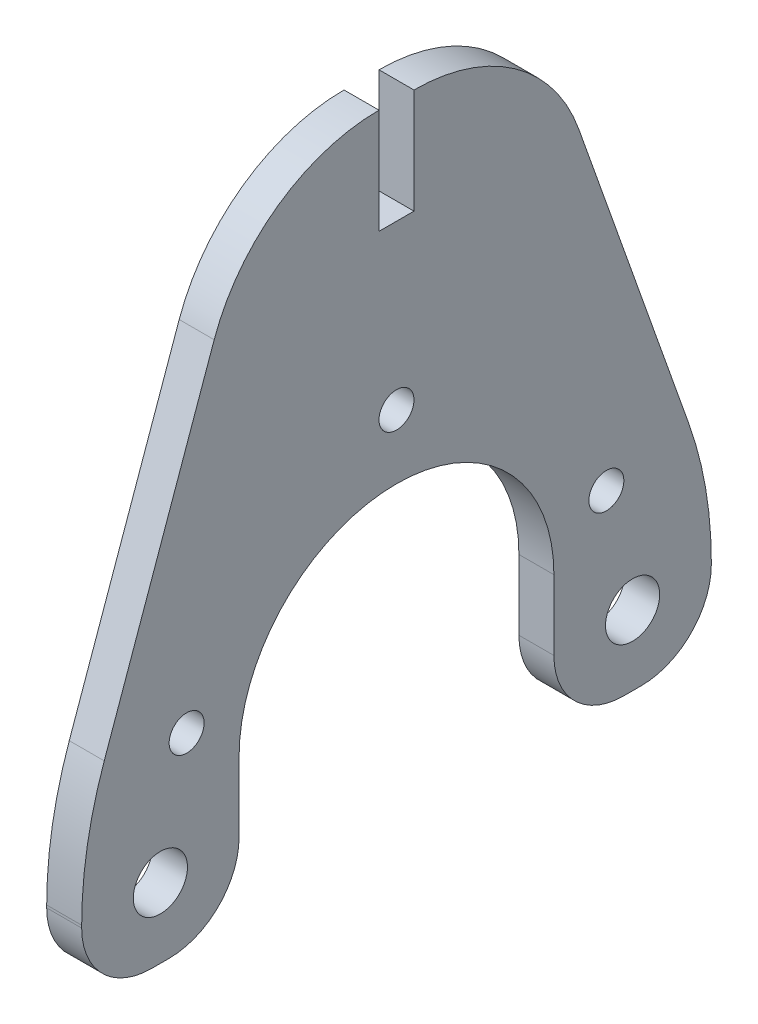
from build123d import *

# Parameters (mm, degrees)
BOSS_EXTRUDE1_DEPTH              = 3.175
F_10_0_1935_DIAMETER_HOLE1_D     = 4.9149
F_10_0_1935_DIAMETER_HOLE1_DEPTH = 19.001994
F_10_0_1935_DIAMETER_HOLE1_TIP   = 1.476584928
SKETCH4_R                        = 1.5875
CUT_EXTRUDE1_DEPTH               = 53.937829102
FILLET2_R                        = 35.56
FILLET1_R                        = 6.35


with BuildPart() as part:
    # Sketch1 → Boss-Extrude1 (new body)
    with BuildSketch(Plane(origin=(0, 0, 0), x_dir=(0, 0, -1), z_dir=(1, 0, 0))):
        with BuildLine():
            Line((1.5875, 44.45), (1.5875, 34.925))
            Line((1.5875, 34.925), (-1.5875, 34.925))
            Line((-1.5875, 34.925), (-1.5875, 44.45))
            ThreePointArc((-1.5875, 44.45), (-10.74499019, 41.54249777), (-16.548096362, 33.885007675))
            Line((-16.548096362, 33.885007675), (-28.575, 0))
            Line((-28.575, 0), (-28.575, -12.7))
            Line((-28.575, -12.7), (-14.2875, -12.7))
            Line((-14.2875, -12.7), (-14.2875, 0))
            ThreePointArc((-14.2875, 0), (0, 14.2875), (14.2875, 0))
            Line((14.2875, 0), (14.2875, -12.7))
            Line((14.2875, -12.7), (28.575, -12.7))
            Line((28.575, -12.7), (28.575, 0))
            Line((28.575, 0), (16.548096362, 33.885007675))
            ThreePointArc((16.548096362, 33.885007675), (10.74499019, 41.54249777), (1.5875, 44.45))
        make_face()
    extrude(amount=BOSS_EXTRUDE1_DEPTH)

    # #10 (0.1935) Diameter Hole1
    with Locations(Plane.ZY):
        with Locations((-21.43125, -6.35), (21.43125, -6.35)):
            Hole(F_10_0_1935_DIAMETER_HOLE1_D / 2, depth=F_10_0_1935_DIAMETER_HOLE1_DEPTH)
            with Locations((0, 0, -(F_10_0_1935_DIAMETER_HOLE1_DEPTH + F_10_0_1935_DIAMETER_HOLE1_TIP / 2))):  # 118° drill point
                Cone(0, F_10_0_1935_DIAMETER_HOLE1_D / 2, F_10_0_1935_DIAMETER_HOLE1_TIP, mode=Mode.SUBTRACT)

    # Sketch4 → Cut-Extrude1 (cut, through all)
    with BuildSketch(Plane(origin=(3.175, 0, 0), x_dir=(0, 0, -1), z_dir=(1, 0, 0))):
        with Locations((0, 20.09775)):
            Circle(SKETCH4_R)
        with Locations((-19.048871022, 4.22275)):
            Circle(SKETCH4_R)
        with Locations((19.048871022, 4.22275)):
            Circle(SKETCH4_R)
    extrude(amount=-CUT_EXTRUDE1_DEPTH, mode=Mode.SUBTRACT)

    # Fillet2
    fillet2_edges = [part.edges().sort_by_distance(p)[0] for p in [
        (1.5875, 0, 28.575),
        (1.5875, 0, -28.575),
    ]]
    fillet(fillet2_edges, radius=FILLET2_R)

    # Fillet1
    fillet1_edges = [part.edges().sort_by_distance(p)[0] for p in [
        (1.5875, -12.7, -28.575),
        (1.5875, -12.7, -14.2875),
        (1.5875, -12.7, 28.575),
        (1.5875, -12.7, 14.2875),
    ]]
    fillet(fillet1_edges, radius=FILLET1_R)


solid = part.part
